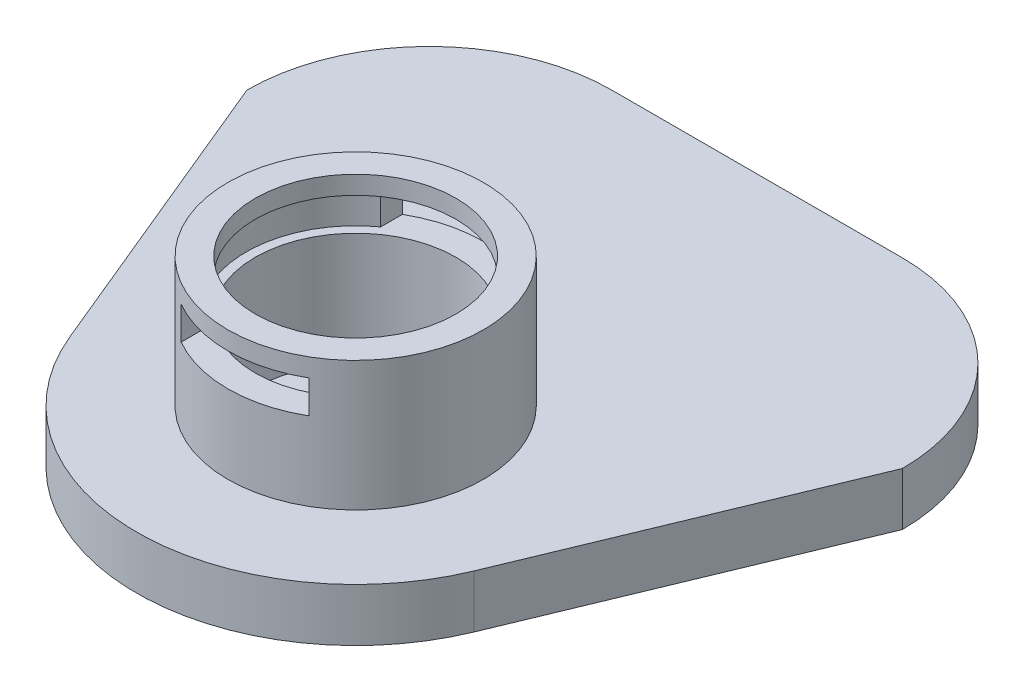
from build123d import *

# Parameters (mm, degrees)
BOSS_EXTRUDE1_DEPTH      = 2.9
SKETCH1_3_R              = 7
BOSS_EXTRUDE2_DEPTH      = 10
SKETCH7_R                = 5.5
CUT_EXTRUDE10_DEPTH      = 9
SKETCH8_R                = 6
SKETCH8_R_2              = 5.5
CUT_EXTRUDE11_DEPTH      = 1.8
CUT_EXTRUDE12_DEPTH      = 31.108725454
CUT_EXTRUDE12_DEPTH_BACK = 31.108725454
SKETCH9_W                = 7
SKETCH9_H                = 1.8


with BuildPart() as part:
    # Sketch1 → Boss-Extrude1 (new body)
    with BuildSketch(Plane(origin=(0, 0, 0), x_dir=(1, 0, 0), z_dir=(0, 1, 0))):
        with BuildLine():
            Line((-17.959269152, 12), (-11.086554257, -4.59220151))
            ThreePointArc((-11.086554257, -4.59220151), (1.96e-07, -12), (11.086554407, -4.592201147))
            Line((11.086554407, -4.592201147), (17.959269152, 12))
            Line((17.959269152, 12), (17.959269152, 12.01))
            ThreePointArc((17.959269152, 12.01), (15.033265896, 19.073996744), (7.969269152, 22))
            Line((7.969269152, 22), (-7.969269152, 22))
            ThreePointArc((-7.969269152, 22), (-15.033265896, 19.073996744), (-17.959269152, 12.01))
            Line((-17.959269152, 12.01), (-17.959269152, 12))
        make_face()
    extrude(amount=BOSS_EXTRUDE1_DEPTH)

    # Sketch1<3> → Boss-Extrude2 (add)
    with BuildSketch(Plane(origin=(0, 0, 0), x_dir=(1, 0, 0), z_dir=(0, 1, 0))):
        Circle(SKETCH1_3_R)
    extrude(amount=BOSS_EXTRUDE2_DEPTH)

    # Sketch7 → Cut-Extrude10 (cut)
    with BuildSketch(Plane(origin=(0, 10, 0), x_dir=(1, 0, 0), z_dir=(0, 1, 0))):
        Circle(SKETCH7_R)
    extrude(amount=-CUT_EXTRUDE10_DEPTH, mode=Mode.SUBTRACT)

    # Sketch8 → Cut-Extrude11 (cut)
    with BuildSketch(Plane(origin=(0, 9, 0), x_dir=(1, 0, 0), z_dir=(0, 1, 0))):
        Circle(SKETCH8_R)
        Circle(SKETCH8_R_2, mode=Mode.SUBTRACT)
    extrude(amount=-CUT_EXTRUDE11_DEPTH, mode=Mode.SUBTRACT)

    # Sketch9 → Cut-Extrude12 (cut, two sides: drawn at the far end of the back side and taken through both)
    with BuildSketch(Plane.XY.offset(-CUT_EXTRUDE12_DEPTH_BACK)):
        with Locations((0, 8.1)):
            Rectangle(SKETCH9_W, SKETCH9_H)
    extrude(amount=CUT_EXTRUDE12_DEPTH + CUT_EXTRUDE12_DEPTH_BACK, mode=Mode.SUBTRACT)


solid = part.part
